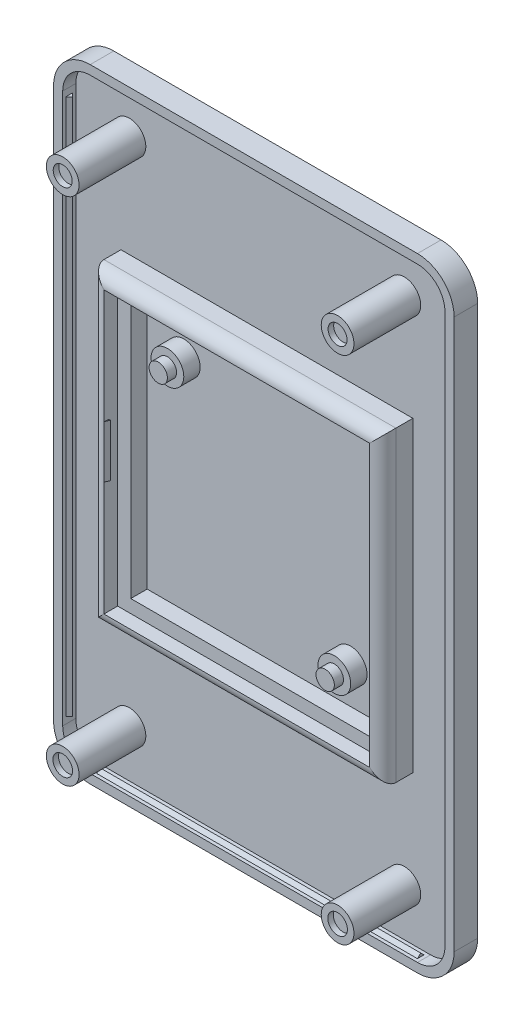
from build123d import *

# Parameters (mm, degrees)
ESQUISSE2_W              = 58.4
ESQUISSE2_H              = 92.4
BOSS_EXTRU_1_DEPTH       = 1.6
CONG_1_R                 = 4.2
ESQUISSE3_W              = 40.6
ESQUISSE3_H              = 42.9
ESQUISSE3_W_2            = 36.6
ESQUISSE3_H_2            = 38.9
EXTRU_MINCE1_DEPTH       = 2.5
ESQUISSE4_R              = 2.5
BOSS_EXTRU_2_DEPTH       = 2.5
ESQUISSE5_R              = 1.4
BOSS_EXTRU_3_DEPTH       = 3.9
ESQUISSE6_R              = 2.5
BOSS_EXTRU_4_DEPTH       = 2.5
ESQUISSE7_R              = 1.4
BOSS_EXTRU_5_DEPTH       = 3.9
ESQUISSE8_W              = 44.6
ESQUISSE8_H              = 46.9
ESQUISSE8_W_2            = 40.6
ESQUISSE8_H_2            = 42.9
EXTRU_MINCE2_DEPTH       = 4.6
CONG_2_R                 = 2
ESQUISSE10_R             = 2.5
BOSS_EXTRU_6_DEPTH       = 10.2
ESQUISSE13_R             = 1.5
ESQUISSE13_R_2           = 1.45
ENL_V_MAT_EXTRU_1_DEPTH  = 0.85
EXTRU_MINCE3_DEPTH       = 2
EXTRU_MINCE3_DEPTH_BACK  = 1.6
BOSS_EXTRU_9_DEPTH       = 4
BOSS_EXTRU_9_DEPTH_BACK  = 4
BOSS_EXTRU_10_DEPTH      = 4
BOSS_EXTRU_10_DEPTH_BACK = 4
BOSS_EXTRU_11_DEPTH      = 41
BOSS_EXTRU_12_DEPTH      = 24.5
ENL_V_MAT_EXTRU_4_DEPTH  = 0.4


with BuildPart() as part:
    # Esquisse2 → Boss.-Extru.1 (new body)
    with BuildSketch(Plane.XY):
        Rectangle(ESQUISSE2_W, ESQUISSE2_H)
    extrude(amount=-BOSS_EXTRU_1_DEPTH)

    # Congé1
    cong_1_edges = [part.edges().sort_by_distance(p)[0] for p in [
        (29.2, -46.2, -0.8),
        (-29.2, -46.2, -0.8),
        (-29.2, 46.2, -0.8),
        (29.2, 46.2, -0.8),
    ]]
    fillet(cong_1_edges, radius=CONG_1_R)

    # Esquisse3 → Extru.-Mince1 (add)
    with BuildSketch(Plane.XY):
        Rectangle(ESQUISSE3_W, ESQUISSE3_H)
        Rectangle(ESQUISSE3_W_2, ESQUISSE3_H_2, mode=Mode.SUBTRACT)
    extrude(amount=EXTRU_MINCE1_DEPTH)

    # Esquisse4 → Boss.-Extru.2 (add)
    with BuildSketch(Plane.XY):
        with Locations(Location((-12.7, 13.95, 0), (0, 0, 180))):
            Circle(ESQUISSE4_R)
    extrude(amount=BOSS_EXTRU_2_DEPTH)

    # Esquisse5 → Boss.-Extru.3 (add)
    with BuildSketch(Plane.XY):
        with Locations((-12.7, 13.95)):
            Circle(ESQUISSE5_R)
    extrude(amount=BOSS_EXTRU_3_DEPTH)

    # Esquisse6 → Boss.-Extru.4 (add)
    with BuildSketch(Plane.XY):
        with Locations(Location((12.8, -13.95, 0), (0, 0, 180))):
            Circle(ESQUISSE6_R)
    extrude(amount=BOSS_EXTRU_4_DEPTH)

    # Esquisse7 → Boss.-Extru.5 (add)
    with BuildSketch(Plane.XY):
        with Locations((12.8, -13.95)):
            Circle(ESQUISSE7_R)
    extrude(amount=BOSS_EXTRU_5_DEPTH)

    # Esquisse8 → Extru.-Mince2 (add)
    with BuildSketch(Plane.XY):
        Rectangle(ESQUISSE8_W, ESQUISSE8_H)
        Rectangle(ESQUISSE8_W_2, ESQUISSE8_H_2, mode=Mode.SUBTRACT)
    extrude(amount=EXTRU_MINCE2_DEPTH)

    # Congé2
    cong_2_edges = [part.edges().sort_by_distance(p)[0] for p in [
        (22.3, 0, 4.6),
        (0, 23.45, 4.6),
        (-22.3, 0, 4.6),
        (0, -23.45, 4.6),
    ]]
    fillet(cong_2_edges, radius=CONG_2_R - 0.0001)  # a hair under: the kernel refuses the full size

    # Esquisse10 → Boss.-Extru.6 (add)
    with BuildSketch(Plane.XY):
        with Locations(Location((21, -39, 0), (0, 0, 180))):
            Circle(ESQUISSE10_R)
        with Locations(Location((-21, -39, 0), (0, 0, 180))):
            Circle(ESQUISSE10_R)
        with Locations(Location((-21, 39, 0), (0, 0, 180))):
            Circle(ESQUISSE10_R)
        with Locations(Location((21, 39, 0), (0, 0, 180))):
            Circle(ESQUISSE10_R)
    extrude(amount=BOSS_EXTRU_6_DEPTH)

    # Esquisse13 → Enlèv. mat.-Extru.1 (cut)
    with BuildSketch(Plane.XY.offset(10.2)):
        with Locations((21, -39)):
            Circle(ESQUISSE13_R)
        with Locations((-21, -39)):
            Circle(ESQUISSE13_R)
        with Locations((-21, 39)):
            Circle(ESQUISSE13_R_2)
        with Locations((21, 39)):
            Circle(ESQUISSE13_R_2)
    extrude(amount=-ENL_V_MAT_EXTRU_1_DEPTH, mode=Mode.SUBTRACT)

    # Esquisse14 → Extru.-Mince3 (add, two sides: drawn at the far end of the back side and taken through both)
    with BuildSketch(Plane.XY.offset(-EXTRU_MINCE3_DEPTH_BACK)):
        with BuildLine():
            Line((-25, -47.6), (25, -47.6))
            ThreePointArc((25, -47.6), (28.959797975, -45.959797975), (30.6, -42))
            Line((30.6, -42), (30.6, 42))
            ThreePointArc((30.6, 42), (28.959797975, 45.959797975), (25, 47.6))
            Line((25, 47.6), (-25, 47.6))
            ThreePointArc((-25, 47.6), (-28.959797975, 45.959797975), (-30.6, 42))
            Line((-30.6, 42), (-30.6, -42))
            ThreePointArc((-30.6, -42), (-28.959797975, -45.959797975), (-25, -47.6))
        make_face()
        with BuildLine():
            Line((-25, -46.2), (25, -46.2))
            ThreePointArc((25, -46.2), (27.969848481, -44.969848481), (29.2, -42))
            Line((29.2, -42), (29.2, 42))
            ThreePointArc((29.2, 42), (27.969848481, 44.969848481), (25, 46.2))
            Line((25, 46.2), (-25, 46.2))
            ThreePointArc((-25, 46.2), (-27.969848481, 44.969848481), (-29.2, 42))
            Line((-29.2, 42), (-29.2, -42))
            ThreePointArc((-29.2, -42), (-27.969848481, -44.969848481), (-25, -46.2))
        make_face(mode=Mode.SUBTRACT)
    extrude(amount=EXTRU_MINCE3_DEPTH + EXTRU_MINCE3_DEPTH_BACK)

    # Esquisse3D7 → Boss.-Extru.9 (add, two sides: drawn at the far end of the back side and taken through both)
    with BuildSketch(Plane(origin=(20.3, 0, 4.6), x_dir=(-0.33633639699815254, -1.1714474630458867e-14, -0.9417419115948389), z_dir=(0, -1, 0)).offset(-BOSS_EXTRU_9_DEPTH_BACK)):
        Polygon((0, 0), (0.659219338, 0.235435478), (0.743303437, 0), align=None)
    extrude(amount=BOSS_EXTRU_9_DEPTH + BOSS_EXTRU_9_DEPTH_BACK)

    # Esquisse3D9 → Boss.-Extru.11 (add, symmetric)
    with BuildSketch(Plane(origin=(29.2, 0, 1), x_dir=(0, 0, -1), z_dir=(0, 1, 0))):
        Polygon((0, 0), (-0.511082321, 0), (0, 0.511082321), (0.511082321, 0), align=None)
    boss_extru_11 = extrude(amount=BOSS_EXTRU_11_DEPTH, both=True)

    # Symétrie1: Boss.-Extru.11 across plane
    add(boss_extru_11.mirror(Plane(origin=(0, 0, 0), x_dir=(0, 0, 1), z_dir=(1, 0, 0))))

    # Esquisse3D12 → Boss.-Extru.12 (add, symmetric)
    with BuildSketch(Plane(origin=(0, 46.2, 1.5), x_dir=(0, 0, -1), z_dir=(-1, 0, 0))):
        Polygon((0, 0), (0.5, 0.5), (1, 0), align=None)
    boss_extru_12 = extrude(amount=BOSS_EXTRU_12_DEPTH, both=True)

    # Symétrie2: Boss.-Extru.12 across plane
    add(boss_extru_12.mirror(Plane.ZX))

    # Esquisse31 → Enlèv. mat.-Extru.4 (cut)
    with BuildSketch(Plane(origin=(0, 0, -1.6), x_dir=(-1, 0, 0), z_dir=(0, 0, -1))):
        with BuildLine():
            add(Edge.make_bspline(
                [(4.349206349, -9.988662132), (3.968253968, -9.83446712), (3.696145125, -9.489795918), (3.632653061, -9.081632653)],
                knots=[0, 0, 0, 0, 1, 1, 1, 1], degree=3))
            add(Edge.make_bspline(
                [(3.632653061, -9.081632653), (3.587301587, -8.845804989), (3.632653061, -8.682539683), (3.995464853, -8.029478458)],
                knots=[1, 1, 1, 1, 2, 2, 2, 2], degree=3))
            add(Edge.make_bspline(
                [(3.995464853, -8.029478458), (5.35600907, -5.580498866), (6.054421769, -2.814058957), (6.01814059, -0.011337868)],
                knots=[2, 2, 2, 2, 3, 3, 3, 3], degree=3))
            add(Edge.make_bspline(
                [(6.01814059, -0.011337868), (6.054421769, 2.709750567), (5.392290249, 5.367346939), (4.0861678, 7.752834467)],
                knots=[3, 3, 3, 3, 4, 4, 4, 4], degree=3))
            add(Edge.make_bspline(
                [(4.0861678, 7.752834467), (3.89569161, 8.151927438), (3.723356009, 8.532879819), (3.578231293, 8.941043084)],
                knots=[4, 4, 4, 4, 5, 5, 5, 5], degree=3))
            add(Edge.make_bspline(
                [(3.578231293, 8.941043084), (3.632653061, 9.285714286), (3.804988662, 9.603174603), (4.0861678, 9.793650794)],
                knots=[5, 5, 5, 5, 6, 6, 6, 6], degree=3))
            add(Edge.make_bspline(
                [(4.0861678, 9.793650794), (4.494331066, 10.011337868), (4.993197279, 9.965986395), (5.365079365, 9.712018141)],
                knots=[6, 6, 6, 6, 7, 7, 7, 7], degree=3))
            add(Edge.make_bspline(
                [(5.365079365, 9.712018141), (5.619047619, 9.385487528), (5.836734694, 9.058956916), (6.01814059, 8.678004535)],
                knots=[7, 7, 7, 7, 8, 8, 8, 8], degree=3))
            add(Edge.make_bspline(
                [(6.01814059, 8.678004535), (6.997732426, 6.79138322), (7.659863946, 4.795918367), (7.986394558, 2.709750567)],
                knots=[8, 8, 8, 8, 9, 9, 9, 9], degree=3))
            add(Edge.make_bspline(
                [(7.986394558, 2.709750567), (8.195011338, 1.068027211), (8.222222222, -0.600907029), (8.068027211, -2.25170068)],
                knots=[9, 9, 9, 9, 10, 10, 10, 10], degree=3))
            add(Edge.make_bspline(
                [(8.068027211, -2.25170068), (7.786848073, -4.37414966), (7.160997732, -6.424036281), (6.199546485, -8.337868481)],
                knots=[10, 10, 10, 10, 11, 11, 11, 11], degree=3))
            add(Edge.make_bspline(
                [(6.199546485, -8.337868481), (5.619047619, -9.498866213), (5.292517007, -9.988662132), (4.947845805, -9.988662132)],
                knots=[11, 11, 11, 11, 12, 12, 12, 12], degree=3))
            add(Edge.make_bspline(
                [(4.947845805, -9.988662132), (4.875283447, -9.988662132), (4.793650794, -9.988662132), (4.721088435, -9.988662132)],
                knots=[12, 12, 12, 12, 13, 13, 13, 13], degree=3))
            add(Edge.make_bspline(
                [(4.721088435, -9.988662132), (4.594104308, -9.988662132), (4.476190476, -9.988662132), (4.349206349, -9.988662132)],
                knots=[13, 13, 13, 13, 14, 14, 14, 14], degree=3))
        make_face()
        with BuildLine():
            add(Edge.make_bspline(
                [(0.394557823, -7.93877551), (0.394557823, -7.953892668), (0.394557823, -7.969009826), (0.394557823, -7.984126984)],
                knots=[9, 9, 9, 9, 10, 10, 10, 10], degree=3))
            add(Edge.make_bspline(
                [(0.394557823, -7.984126984), (-0.12244898, -7.839002268), (-0.448979592, -7.31292517), (-0.340136054, -6.786848073)],
                knots=[0, 0, 0, 0, 1, 1, 1, 1], degree=3))
            add(Edge.make_bspline(
                [(-0.340136054, -6.786848073), (-0.340136054, -6.678004535), (-0.058956916, -6.179138322), (0.195011338, -5.671201814)],
                knots=[1, 1, 1, 1, 2, 2, 2, 2], degree=3))
            add(Edge.make_bspline(
                [(0.195011338, -5.671201814), (1.265306122, -3.612244898), (1.727891156, -1.290249433), (1.519274376, 1.022675737)],
                knots=[2, 2, 2, 2, 3, 3, 3, 3], degree=3))
            add(Edge.make_bspline(
                [(1.519274376, 1.022675737), (1.392290249, 2.682539683), (0.911564626, 4.297052154), (0.12244898, 5.757369615)],
                knots=[3, 3, 3, 3, 4, 4, 4, 4], degree=3))
            add(Edge.make_bspline(
                [(0.12244898, 5.757369615), (-0.448979592, 6.900226757), (-0.485260771, 7.081632653), (-0.149659864, 7.571428571)],
                knots=[4, 4, 4, 4, 5, 5, 5, 5], degree=3))
            add(Edge.make_bspline(
                [(-0.149659864, 7.571428571), (0.249433107, 8.015873016), (0.911564626, 8.079365079), (1.401360544, 7.698412698)],
                knots=[5, 5, 5, 5, 6, 6, 6, 6], degree=3))
            add(Edge.make_bspline(
                [(1.401360544, 7.698412698), (2.054421769, 6.736961451), (2.571428571, 5.684807256), (2.952380952, 4.578231293)],
                knots=[6, 6, 6, 6, 7, 7, 7, 7], degree=3))
            add(Edge.make_bspline(
                [(2.952380952, 4.578231293), (4.113378685, 1.140589569), (3.931972789, -2.605442177), (2.444444444, -5.907029478)],
                knots=[7, 7, 7, 7, 8, 8, 8, 8], degree=3))
            add(Edge.make_bspline(
                [(2.444444444, -5.907029478), (1.682539683, -7.621315193), (1.14739229, -8.174603175), (0.394557823, -7.93877551)],
                knots=[8, 8, 8, 8, 9, 9, 9, 9], degree=3))
        make_face()
        with BuildLine():
            add(Edge.make_bspline(
                [(-3.68707483, -5.907029478), (-3.68707483, -5.925170068), (-3.68707483, -5.943310658), (-3.68707483, -5.961451247)],
                knots=[10, 10, 10, 10, 11, 11, 11, 11], degree=3))
            add(Edge.make_bspline(
                [(-3.68707483, -5.961451247), (-4.013605442, -5.816326531), (-4.258503401, -5.526077098), (-4.349206349, -5.181405896)],
                knots=[0, 0, 0, 0, 1, 1, 1, 1], degree=3))
            add(Edge.make_bspline(
                [(-4.349206349, -5.181405896), (-4.349206349, -5), (-4.349206349, -4.764172336), (-3.941043084, -4.038548753)],
                knots=[1, 1, 1, 1, 2, 2, 2, 2], degree=3))
            add(Edge.make_bspline(
                [(-3.941043084, -4.038548753), (-2.589569161, -1.589569161), (-2.589569161, 1.385487528), (-3.941043084, 3.83446712)],
                knots=[2, 2, 2, 2, 3, 3, 3, 3], degree=3))
            add(Edge.make_bspline(
                [(-3.941043084, 3.83446712), (-4.530612245, 4.977324263), (-4.530612245, 5.213151927), (-4.049886621, 5.648526077)],
                knots=[3, 3, 3, 3, 4, 4, 4, 4], degree=3))
            add(Edge.make_bspline(
                [(-4.049886621, 5.648526077), (-3.87755102, 5.848072562), (-3.623582766, 5.947845805), (-3.351473923, 5.911564626)],
                knots=[4, 4, 4, 4, 5, 5, 5, 5], degree=3))
            add(Edge.make_bspline(
                [(-3.351473923, 5.911564626), (-2.770975057, 5.911564626), (-2.444444444, 5.630385488), (-1.954648526, 4.605442177)],
                knots=[5, 5, 5, 5, 6, 6, 6, 6], degree=3))
            add(Edge.make_bspline(
                [(-1.954648526, 4.605442177), (-1.183673469, 3.19047619), (-0.784580499, 1.603174603), (-0.793650794, -0.011337868)],
                knots=[6, 6, 6, 6, 7, 7, 7, 7], degree=3))
            add(Edge.make_bspline(
                [(-0.793650794, -0.011337868), (-0.757369615, -1.653061224), (-1.156462585, -3.285714286), (-1.945578231, -4.727891156)],
                knots=[7, 7, 7, 7, 8, 8, 8, 8], degree=3))
            add(Edge.make_bspline(
                [(-1.945578231, -4.727891156), (-2.43537415, -5.680272109), (-2.680272109, -5.907029478), (-3.170068027, -5.988662132)],
                knots=[8, 8, 8, 8, 9, 9, 9, 9], degree=3))
            add(Edge.make_bspline(
                [(-3.170068027, -5.988662132), (-3.342403628, -6.006802721), (-3.523809524, -5.988662132), (-3.68707483, -5.907029478)],
                knots=[9, 9, 9, 9, 10, 10, 10, 10], degree=3))
        make_face()
        with BuildLine():
            add(Edge.make_bspline(
                [(-7.496598639, -4.029478458), (-7.499622071, -4.029478458), (-7.502645503, -4.029478458), (-7.505668934, -4.029478458)],
                knots=[9, 9, 9, 9, 10, 10, 10, 10], degree=3))
            add(Edge.make_bspline(
                [(-7.505668934, -4.029478458), (-7.804988662, -3.884353741), (-8.040816327, -3.639455782), (-8.158730159, -3.321995465)],
                knots=[0, 0, 0, 0, 1, 1, 1, 1], degree=3))
            add(Edge.make_bspline(
                [(-8.158730159, -3.321995465), (-8.249433107, -3.004535147), (-8.158730159, -2.732426304), (-7.795918367, -2.151927438)],
                knots=[1, 1, 1, 1, 2, 2, 2, 2], degree=3))
            add(Edge.make_bspline(
                [(-7.795918367, -2.151927438), (-7.342403628, -1.535147392), (-7.124716553, -0.77324263), (-7.170068027, -0.011337868)],
                knots=[2, 2, 2, 2, 3, 3, 3, 3], degree=3))
            add(Edge.make_bspline(
                [(-7.170068027, -0.011337868), (-7.106575964, 0.759637188), (-7.315192744, 1.52154195), (-7.759637188, 2.156462585)],
                knots=[3, 3, 3, 3, 4, 4, 4, 4], degree=3))
            add(Edge.make_bspline(
                [(-7.759637188, 2.156462585), (-7.9138322, 2.383219955), (-8.040816327, 2.628117914), (-8.158730159, 2.873015873)],
                knots=[4, 4, 4, 4, 5, 5, 5, 5], degree=3))
            add(Edge.make_bspline(
                [(-8.158730159, 2.873015873), (-8.258503401, 3.444444444), (-7.87755102, 3.988662132), (-7.25170068, 4.097505669)],
                knots=[5, 5, 5, 5, 6, 6, 6, 6], degree=3))
            add(Edge.make_bspline(
                [(-7.25170068, 4.097505669), (-6.761904762, 4.188208617), (-6.41723356, 3.979591837), (-5.963718821, 3.290249433)],
                knots=[6, 6, 6, 6, 7, 7, 7, 7], degree=3))
            add(Edge.make_bspline(
                [(-5.963718821, 3.290249433), (-4.648526077, 1.285714286), (-4.648526077, -1.299319728), (-5.963718821, -3.303854875)],
                knots=[7, 7, 7, 7, 8, 8, 8, 8], degree=3))
            add(Edge.make_bspline(
                [(-5.963718821, -3.303854875), (-6.426303855, -4.002267574), (-6.952380952, -4.210884354), (-7.496598639, -4.029478458)],
                knots=[8, 8, 8, 8, 9, 9, 9, 9], degree=3))
        make_face()
    extrude(amount=-ENL_V_MAT_EXTRU_4_DEPTH, mode=Mode.SUBTRACT)


with BuildPart() as body_2:
    # Esquisse3D8 → Boss.-Extru.10 (new, two sides: drawn at the far end of the back side and taken through both)
    with BuildSketch(Plane(origin=(-20.3, 0, 4.6), x_dir=(0.39433589448719514, 0, -0.9189663771428114), z_dir=(0, 1, 0)).offset(-BOSS_EXTRU_10_DEPTH_BACK)):
        Polygon((0, 0), (0.745079558, 0), (0.672937939, 0.220333457), align=None)
    extrude(amount=BOSS_EXTRU_10_DEPTH + BOSS_EXTRU_10_DEPTH_BACK)


solid = Compound([part.part, body_2.part])
